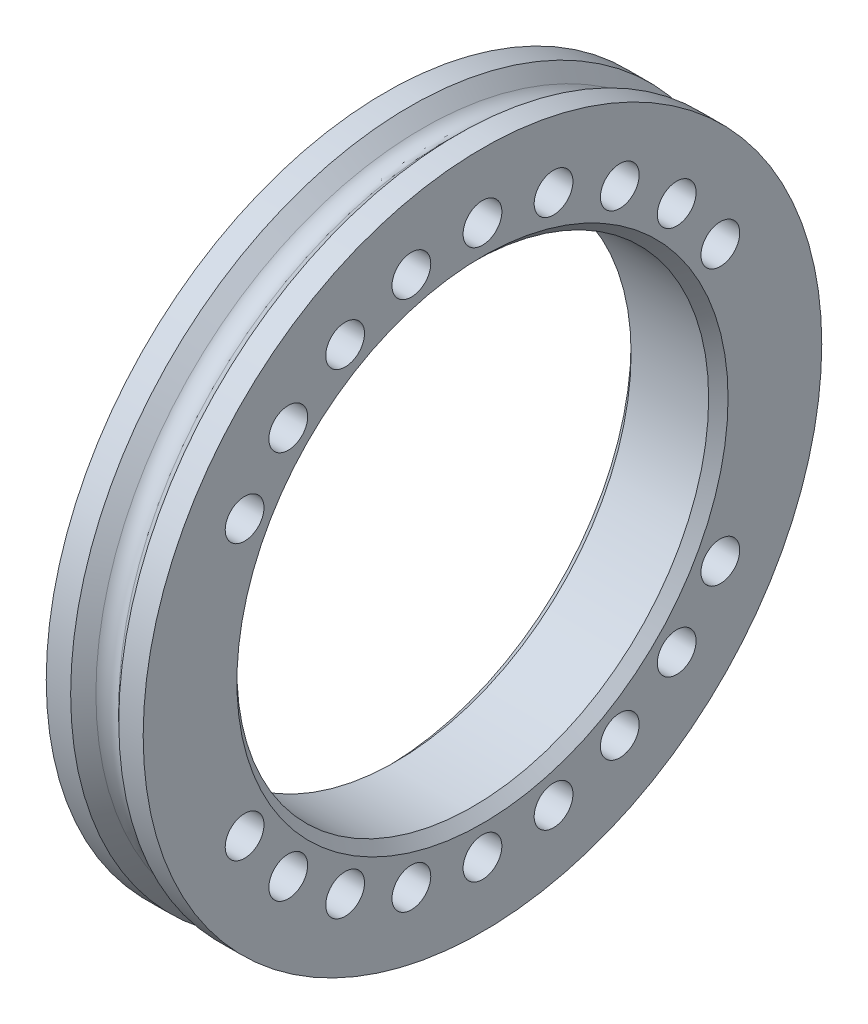
from build123d import *

# Parameters (mm, degrees)
CHAMFER1_SIZE                   = 3
FILLET3_R                       = 5
SKETCH3_R                       = 6
CUT_EXTRUDE3_DEPTH              = 152.492574214
CIRPATTERN2_COUNT               = 5
CIRPATTERN2_ANGLE               = 60
CIRPATTERN2_THE_OTHER_WAY_COUNT = 5
CIRPATTERN2_THE_OTHER_WAY_ANGLE = 60
MIRROR1_COPY_1_SKETCH_R         = 6
MIRROR1_COPY_1_DEPTH            = 152.492574214
MIRROR1_COPY_2_SKETCH_R         = 6
MIRROR1_COPY_2_DEPTH            = 152.492574214
MIRROR1_COPY_3_SKETCH_R         = 6
MIRROR1_COPY_3_DEPTH            = 152.492574214
MIRROR1_COPY_4_SKETCH_R         = 6
MIRROR1_COPY_4_DEPTH            = 152.492574214
MIRROR1_COPY_5_SKETCH_R         = 6
MIRROR1_COPY_5_DEPTH            = 152.492574214
MIRROR1_COPY_6_SKETCH_R         = 6
MIRROR1_COPY_6_DEPTH            = 152.492574214
MIRROR1_COPY_7_SKETCH_R         = 6
MIRROR1_COPY_7_DEPTH            = 152.492574214
MIRROR1_COPY_8_SKETCH_R         = 6
MIRROR1_COPY_8_DEPTH            = 152.492574214
MIRROR1_COPY_9_SKETCH_R         = 6
MIRROR1_COPY_9_DEPTH            = 152.492574214


with BuildPart() as part:
    # Sketch1 → Revolve1 (revolve)
    with BuildSketch(Plane.XY):
        Polygon((15, 105), (7.442388155, 105), (0, 97.557611845), (-7.442388155, 105), (-15, 105), (-15, 73), (15, 73), align=None)
    revolve(axis=Axis((0, 0, 0), (1, 0, 0)))

    # Chamfer1
    chamfer1_edges = [part.edges().sort_by_distance(p)[0] for p in [
        (15, -73, 0),
        (-15, -73, 0),
    ]]
    chamfer(chamfer1_edges, length=CHAMFER1_SIZE)

    # Fillet3
    fillet3_edges = [part.edges().sort_by_distance(p)[0] for p in [
        (0, -97.557611845, 0),
    ]]
    fillet(fillet3_edges, radius=FILLET3_R)

    # Sketch3 → Cut-Extrude3 (cut, through all)
    with BuildSketch(Plane(origin=(15, 0, 0), x_dir=(0, 0, -1), z_dir=(1, 0, 0))):
        with Locations((0, 85)):
            Circle(SKETCH3_R)
    cut_extrude3 = extrude(amount=-CUT_EXTRUDE3_DEPTH, mode=Mode.SUBTRACT)

    # CirPattern2: Cut-Extrude3 ×5 about axis
    cirpattern2_axis = Axis((12, 0, 0), (-1, 0, 0))
    for i in range(1, CIRPATTERN2_COUNT):
        add(cut_extrude3.rotate(cirpattern2_axis, i * CIRPATTERN2_ANGLE / (CIRPATTERN2_COUNT - 1)), mode=Mode.SUBTRACT)

    # CirPattern2 the other way: Cut-Extrude3 ×5 about axis
    cirpattern2_the_other_way_axis = Axis((12, 0, 0), (1, 0, 0))
    for i in range(1, CIRPATTERN2_THE_OTHER_WAY_COUNT):
        add(cut_extrude3.rotate(cirpattern2_the_other_way_axis, i * CIRPATTERN2_THE_OTHER_WAY_ANGLE / (CIRPATTERN2_THE_OTHER_WAY_COUNT - 1)), mode=Mode.SUBTRACT)

    # Mirror1 copy 1 sketch → Mirror1 copy 1 (cut, through all)
    with BuildSketch(Plane(origin=(15, 0, 0), x_dir=(0, 0.2588190451025214, -0.9659258262890681), z_dir=(1, 0, 0))):
        with Locations((0, -85)):
            Circle(MIRROR1_COPY_1_SKETCH_R)
    extrude(amount=-MIRROR1_COPY_1_DEPTH, mode=Mode.SUBTRACT)

    # Mirror1 copy 2 sketch → Mirror1 copy 2 (cut, through all)
    with BuildSketch(Plane(origin=(15, 0, 0), x_dir=(0, 0.5000000000000011, -0.866025403784438), z_dir=(1, 0, 0))):
        with Locations((0, -85)):
            Circle(MIRROR1_COPY_2_SKETCH_R)
    extrude(amount=-MIRROR1_COPY_2_DEPTH, mode=Mode.SUBTRACT)

    # Mirror1 copy 3 sketch → Mirror1 copy 3 (cut, through all)
    with BuildSketch(Plane(origin=(15, 0, 0), x_dir=(0, 0.7071067811865488, -0.7071067811865462), z_dir=(1, 0, 0))):
        with Locations((0, -85)):
            Circle(MIRROR1_COPY_3_SKETCH_R)
    extrude(amount=-MIRROR1_COPY_3_DEPTH, mode=Mode.SUBTRACT)

    # Mirror1 copy 4 sketch → Mirror1 copy 4 (cut, through all)
    with BuildSketch(Plane(origin=(15, 0, 0), x_dir=(0, 0.8660254037844399, -0.4999999999999978), z_dir=(1, 0, 0))):
        with Locations((0, -85)):
            Circle(MIRROR1_COPY_4_SKETCH_R)
    extrude(amount=-MIRROR1_COPY_4_DEPTH, mode=Mode.SUBTRACT)

    # Mirror1 copy 5 sketch → Mirror1 copy 5 (cut, through all)
    with BuildSketch(Plane(origin=(15, 0, 0), x_dir=(0, -0.2588190451025214, -0.9659258262890681), z_dir=(1, 0, 0))):
        with Locations((0, -85)):
            Circle(MIRROR1_COPY_5_SKETCH_R)
    extrude(amount=-MIRROR1_COPY_5_DEPTH, mode=Mode.SUBTRACT)

    # Mirror1 copy 6 sketch → Mirror1 copy 6 (cut, through all)
    with BuildSketch(Plane(origin=(15, 0, 0), x_dir=(0, -0.5000000000000011, -0.866025403784438), z_dir=(1, 0, 0))):
        with Locations((0, -85)):
            Circle(MIRROR1_COPY_6_SKETCH_R)
    extrude(amount=-MIRROR1_COPY_6_DEPTH, mode=Mode.SUBTRACT)

    # Mirror1 copy 7 sketch → Mirror1 copy 7 (cut, through all)
    with BuildSketch(Plane(origin=(15, 0, 0), x_dir=(0, -0.7071067811865488, -0.7071067811865462), z_dir=(1, 0, 0))):
        with Locations((0, -85)):
            Circle(MIRROR1_COPY_7_SKETCH_R)
    extrude(amount=-MIRROR1_COPY_7_DEPTH, mode=Mode.SUBTRACT)

    # Mirror1 copy 8 sketch → Mirror1 copy 8 (cut, through all)
    with BuildSketch(Plane(origin=(15, 0, 0), x_dir=(0, -0.8660254037844399, -0.4999999999999978), z_dir=(1, 0, 0))):
        with Locations((0, -85)):
            Circle(MIRROR1_COPY_8_SKETCH_R)
    extrude(amount=-MIRROR1_COPY_8_DEPTH, mode=Mode.SUBTRACT)

    # Mirror1 copy 9 sketch → Mirror1 copy 9 (cut, through all)
    with BuildSketch(Plane(origin=(15, 0, 0), x_dir=(0, 0, -1), z_dir=(1, 0, 0))):
        with Locations((0, -85)):
            Circle(MIRROR1_COPY_9_SKETCH_R)
    extrude(amount=-MIRROR1_COPY_9_DEPTH, mode=Mode.SUBTRACT)


solid = part.part
